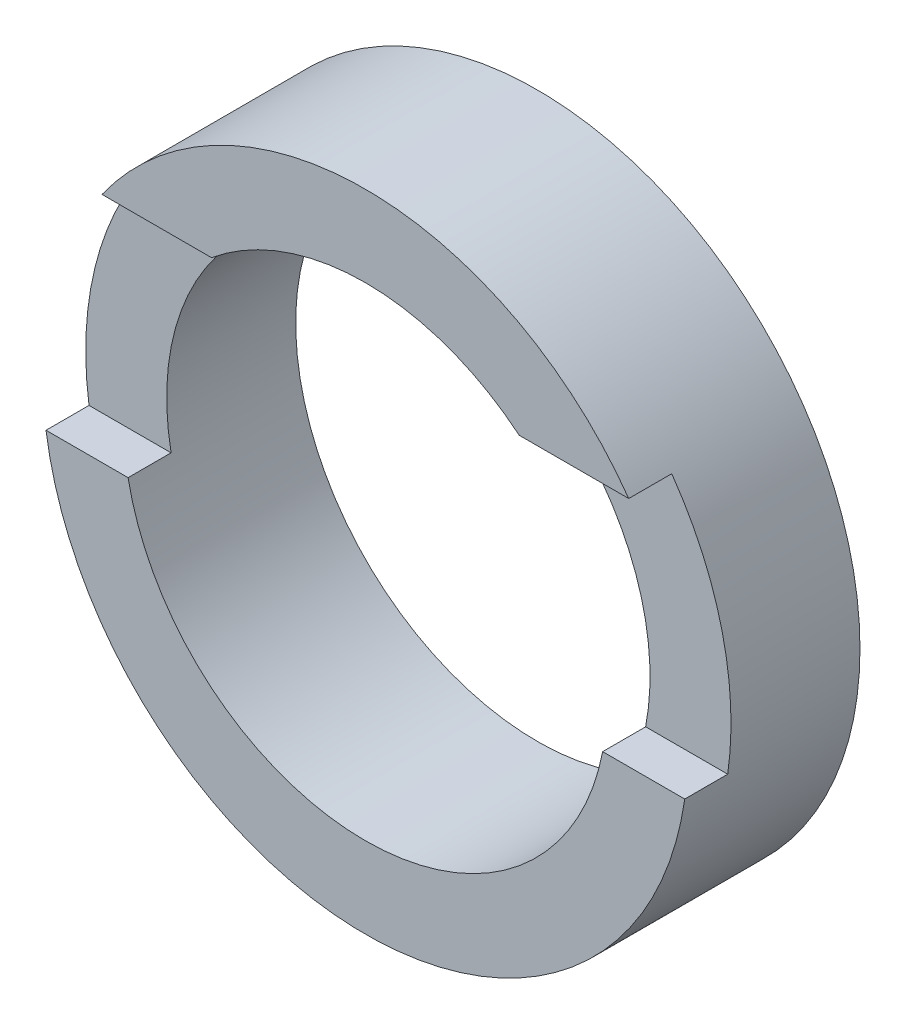
from build123d import *

# Parameters (mm, degrees)
SKIZZE1_R                       = 37.521428571
SKIZZE1_R_2                     = 28.105528142
AUFSATZ_LINEAR_AUSTRAGEN1_DEPTH = 20
SKIZZE2_W                       = 104.938907303
SKIZZE2_H                       = 27.007069211
SCHNITT_LINEAR_AUSTRAGEN1_DEPTH = 5


with BuildPart() as part:
    # Skizze1 → Aufsatz-Linear austragen1 (new body)
    with BuildSketch(Plane.XY):
        Circle(SKIZZE1_R)
        Circle(SKIZZE1_R_2, mode=Mode.SUBTRACT)
    extrude(amount=AUFSATZ_LINEAR_AUSTRAGEN1_DEPTH)

    # Skizze2 → Schnitt-Linear austragen1 (cut)
    with BuildSketch(Plane.XY.offset(20)):
        with Locations((2.939883917, 8.171880721)):
            Rectangle(SKIZZE2_W, SKIZZE2_H)
    extrude(amount=-SCHNITT_LINEAR_AUSTRAGEN1_DEPTH, mode=Mode.SUBTRACT)


solid = part.part
